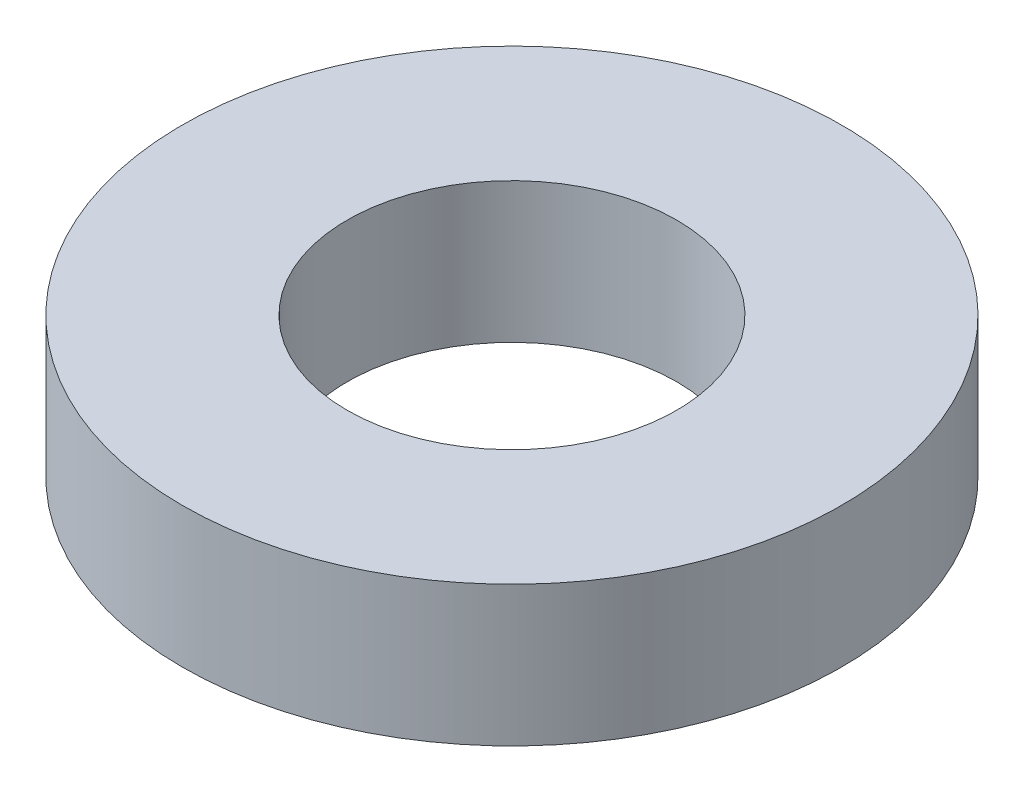
from build123d import *

# Parameters (mm, degrees)
SKETCH1_R           = 40
BOSS_EXTRUDE1_DEPTH = 17
SKETCH2_R           = 20
CUT_EXTRUDE1_DEPTH  = 60.067757702


with BuildPart() as part:
    # Sketch1 → Boss-Extrude1 (new body)
    with BuildSketch(Plane(origin=(0, 0, 0), x_dir=(1, 0, 0), z_dir=(0, 1, 0))):
        Circle(SKETCH1_R)
    extrude(amount=BOSS_EXTRUDE1_DEPTH)

    # Sketch2 → Cut-Extrude1 (cut, through all)
    with BuildSketch(Plane(origin=(0, 0, 0), x_dir=(1, 0, 0), z_dir=(0, 1, 0))):
        Circle(SKETCH2_R)
    extrude(amount=CUT_EXTRUDE1_DEPTH, mode=Mode.SUBTRACT)


solid = part.part
